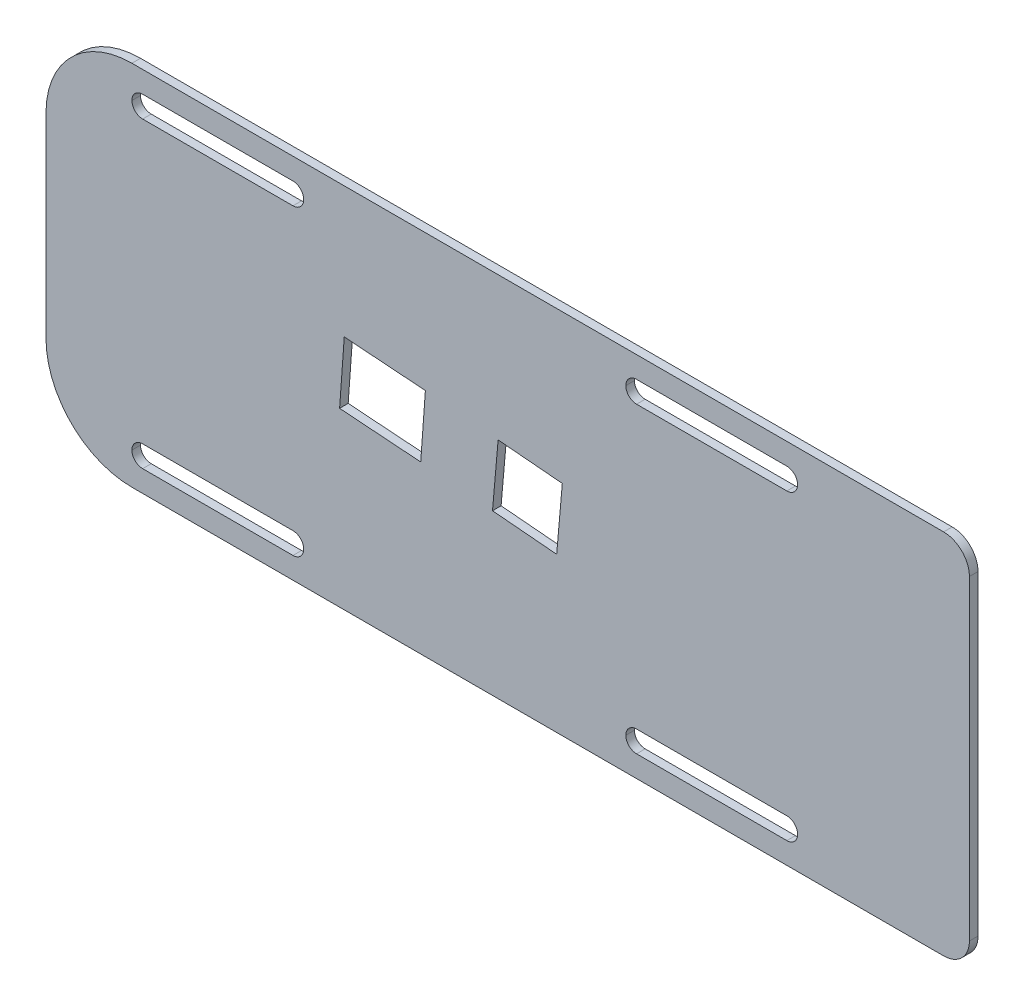
from build123d import *

# Parameters (mm, degrees)
ESQUISSE1_W             = 215
ESQUISSE1_H             = 85.5
ESQUISSE1_W_2           = 40
ESQUISSE1_H_2           = 5
BOSS_EXTRU_1_DEPTH      = 2
CONG_1_R                = 6
CONG_2_R                = 20
CONG_3_R                = 2.5
ENL_V_MAT_EXTRU_1_REACH = 233.386


with BuildPart() as part:
    # Esquisse1 → Boss.-Extru.1 (new body)
    with BuildSketch(Plane.XY):
        with Locations((107.5, 42.75)):
            Rectangle(ESQUISSE1_W, ESQUISSE1_H)
        with Locations((155, 7.5)):
            Rectangle(ESQUISSE1_W_2, ESQUISSE1_H_2, mode=Mode.SUBTRACT)
        with Locations((155, 78)):
            Rectangle(ESQUISSE1_W_2, ESQUISSE1_H_2, mode=Mode.SUBTRACT)
        with Locations((40, 7.5)):
            Rectangle(ESQUISSE1_W_2, ESQUISSE1_H_2, mode=Mode.SUBTRACT)
        with Locations((40, 78)):
            Rectangle(ESQUISSE1_W_2, ESQUISSE1_H_2, mode=Mode.SUBTRACT)
    extrude(amount=BOSS_EXTRU_1_DEPTH)

    # Congé1
    cong_1_edges = [part.edges().sort_by_distance(p)[0] for p in [
        (215, 85.5, 1),
        (215, 0, 1),
    ]]
    fillet(cong_1_edges, radius=CONG_1_R)

    # Congé2
    cong_2_edges = [part.edges().sort_by_distance(p)[0] for p in [
        (0, 85.5, 1),
        (0, 0, 1),
    ]]
    fillet(cong_2_edges, radius=CONG_2_R)

    # Congé3
    cong_3_edges = [part.edges().sort_by_distance(p)[0] for p in [
        (20, 80.5, 1),
        (20, 75.5, 1),
        (60, 75.5, 1),
        (60, 80.5, 1),
        (60, 10, 1),
        (60, 5, 1),
        (20, 5, 1),
        (20, 10, 1),
        (135, 10, 1),
        (135, 5, 1),
        (175, 10, 1),
        (175, 5, 1),
        (135, 80.5, 1),
        (135, 75.5, 1),
        (175, 75.5, 1),
        (175, 80.5, 1),
    ]]
    fillet(cong_3_edges, radius=CONG_3_R - 0.0001)  # a hair under: the kernel refuses the full size

    # Esquisse2 → Enlèv. mat.-Extru.1 (cut, up to next)
    with BuildSketch(Plane(origin=(0, 0, 0), x_dir=(-1, 0, 0), z_dir=(0, 0, -1)), mode=Mode.PRIVATE) as enl_v_mat_extru_1_sk1:
        Polygon((-87.246997481, 38.721191603), (-88.332391174, 53.664112074), (-69.444138278, 55.03607886), (-68.358744585, 40.093158389), align=None)
    enl_v_mat_extru_1_tool1 = extrude(enl_v_mat_extru_1_sk1.sketch, amount=-ENL_V_MAT_EXTRU_1_REACH, mode=Mode.PRIVATE) & part.part
    # Esquisse2 → Enlèv. mat.-Extru.1 (cut, up to next)
    with BuildSketch(Plane(origin=(0, 0, 0), x_dir=(-1, 0, 0), z_dir=(0, 0, -1)), mode=Mode.PRIVATE) as enl_v_mat_extru_1_sk2:
        Polygon((-118.903285372, 35.932207835), (-120.210621513, 50.875128306), (-105.267701042, 52.182464448), (-103.9603649, 37.239543976), align=None)
    enl_v_mat_extru_1_tool2 = extrude(enl_v_mat_extru_1_sk2.sketch, amount=-ENL_V_MAT_EXTRU_1_REACH, mode=Mode.PRIVATE) & part.part
    add(enl_v_mat_extru_1_tool1.solids().sort_by_distance((78.345568, 46.878635, 0))[0], mode=Mode.SUBTRACT)
    add(enl_v_mat_extru_1_tool2.solids().sort_by_distance((112.085493, 44.057336, 0))[0], mode=Mode.SUBTRACT)


solid = part.part
